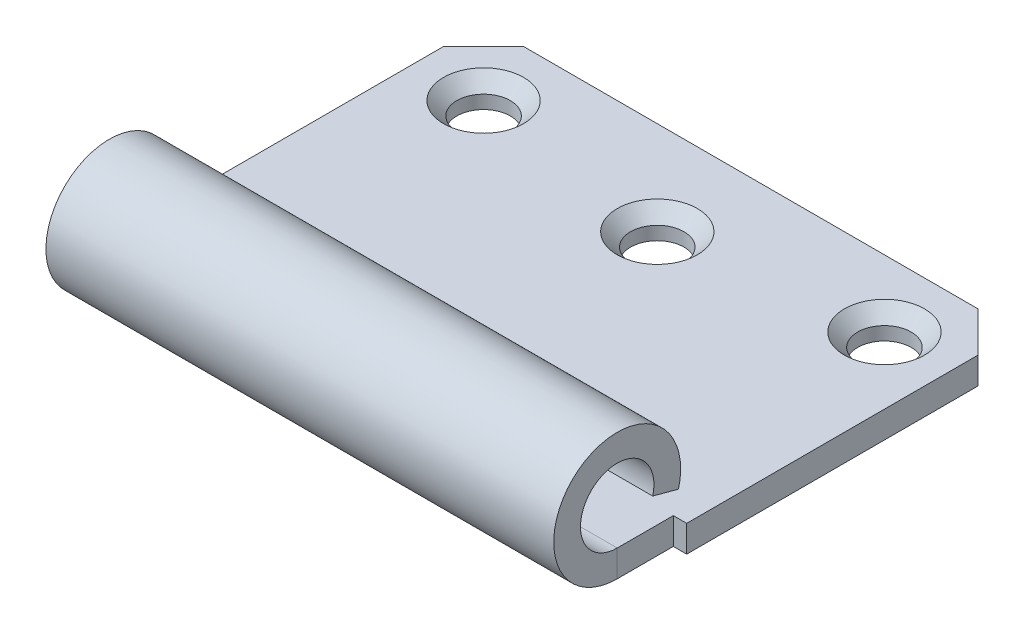
from build123d import *

# Parameters (mm, degrees)
SKETCH1_W           = 40
SKETCH1_H           = 29
BASE_FLANGE1_DEPTH  = 2
BREAK_CORNER1_START = -2
BREAK_CORNER1_DEPTH = 2
HEM2_START          = -19
HEM2_DEPTH          = 38
SKETCH10_W          = 1
SKETCH10_H          = 4.2
CUT_EXTRUDE1_DEPTH  = 10
SKETCH11_R          = 2
CUT_EXTRUDE2_DEPTH  = 2
CHAMFER1_SIZE       = 1


# Read off the part's stored shape, not the designer's step: Break-Corner1, Hem2
# Sheet-metal steps are written as plain solids
with BuildPart() as part:
    # Sketch1 → Base-Flange1 (new body)
    with BuildSketch(Plane(origin=(0, 0, 0), x_dir=(1, 0, 0), z_dir=(0, 1, 0))):
        Rectangle(SKETCH1_W, SKETCH1_H)
    extrude(amount=-BASE_FLANGE1_DEPTH)

    # Break-Corner1 outline → Break-Corner1 (cut)
    with BuildSketch(Plane(origin=(0, 0, 0), x_dir=(1, 0, 0), z_dir=(0, 1, 0)).offset(BREAK_CORNER1_START)):
        Polygon((-20, 14.5), (-20, 11.5), (-17, 14.5), align=None)
        Polygon((20, 14.5), (17, 14.5), (20, 11.5), align=None)
    extrude(amount=BREAK_CORNER1_DEPTH, mode=Mode.SUBTRACT)

    # Hem2 outline → Hem2 (add)
    with BuildSketch(Plane.YZ.offset(HEM2_START)):
        with BuildLine():
            Line((2.038247626, 11.843703978), (1.520609536, 9.911852325))
            ThreePointArc((1.520609536, 9.911852325), (6.518428366, 17.391616788), (-2, 14.5))
            Line((-2, 14.5), (0, 14.5))
            ThreePointArc((0, 14.5), (4.931721686, 16.17409393), (2.038247626, 11.843703978))
        make_face()
    extrude(amount=HEM2_DEPTH)

    # Sketch10 → Cut-Extrude1 (cut)
    with BuildSketch(Plane(origin=(0, 0, 0), x_dir=(1, 0, 0), z_dir=(0, 1, 0))):
        with Locations((19.5, -12.4)):
            Rectangle(SKETCH10_W, SKETCH10_H)
        with Locations((-19.5, -12.4)):
            Rectangle(SKETCH10_W, SKETCH10_H)
    extrude(amount=-CUT_EXTRUDE1_DEPTH, mode=Mode.SUBTRACT)

    # Sketch11 → Cut-Extrude2 (cut)
    with BuildSketch(Plane(origin=(0, 0, 0), x_dir=(1, 0, 0), z_dir=(0, 1, 0))):
        with Locations(Location((-15, 9.5, 0), (0, 0, 270))):
            Circle(SKETCH11_R)
        with Locations(Location((0, 7.5, 0), (0, 0, 270))):
            Circle(SKETCH11_R)
        with Locations(Location((15, 9.5, 0), (0, 0, 270))):
            Circle(SKETCH11_R)
    extrude(amount=-CUT_EXTRUDE2_DEPTH, mode=Mode.SUBTRACT)

    # Chamfer1
    chamfer1_edges = [part.edges().sort_by_distance(p)[0] for p in [
        (-15, 0, -11.5),
        (0, 0, -9.5),
        (15, 0, -11.5),
    ]]
    chamfer(chamfer1_edges, length=CHAMFER1_SIZE)


solid = part.part
